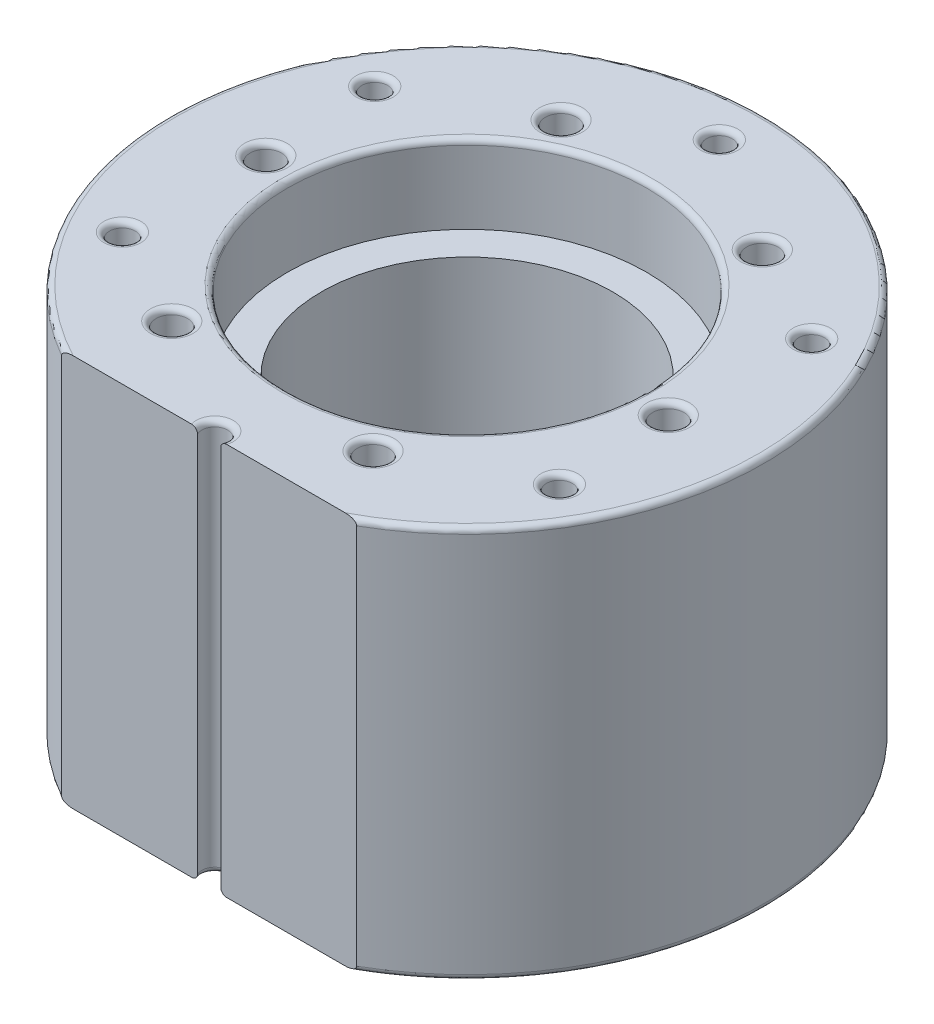
from build123d import *

# Parameters (mm, degrees)
SKETCH2_R          = 1.4
CUT_EXTRUDE1_DEPTH = 20
SKETCH4_R          = 1.15
CUT_EXTRUDE2_DEPTH = 52.278650528
FILLET1_R          = 0.5
SKETCH6_W          = 121.102594462
SKETCH6_H          = 9.633160923
CUT_EXTRUDE3_DEPTH = 52.278650528


with BuildPart() as part:
    # Sketch1 → Revolve1 (revolve)
    with BuildSketch(Plane.XY):
        Polygon((16.025, 35), (26.5, 35), (26.5, 0), (13, 0), (13, 28), (16.025, 28), align=None)
    revolve(axis=Axis((0, 0, 0), (0, 1, 0)))

    # Sketch2 → Cut-Extrude1 (cut)
    with BuildSketch(Plane(origin=(0, 35, 0), x_dir=(1, 0, 0), z_dir=(0, 1, 0))):
        with Locations((-8.590503645, 16.975095644)):
            Circle(SKETCH2_R)
        with Locations((10.405612237, 15.92714221)):
            Circle(SKETCH2_R)
        with Locations((18.996115882, -1.047953434)):
            Circle(SKETCH2_R)
        with Locations((8.590503645, -16.975095644)):
            Circle(SKETCH2_R)
        with Locations((-10.405612237, -15.92714221)):
            Circle(SKETCH2_R)
        with Locations((-18.996115882, 1.047953434)):
            Circle(SKETCH2_R)
    extrude(amount=-CUT_EXTRUDE1_DEPTH, mode=Mode.SUBTRACT)

    # Sketch4 → Cut-Extrude2 (cut, through all)
    with BuildSketch(Plane.XZ):
        with Locations((0, 22.5)):
            Circle(SKETCH4_R)
        with Locations((19.485571585, 11.25)):
            Circle(SKETCH4_R)
        with Locations((19.485571585, -11.25)):
            Circle(SKETCH4_R)
        with Locations((0, -22.5)):
            Circle(SKETCH4_R)
        with Locations((-19.485571585, -11.25)):
            Circle(SKETCH4_R)
        with Locations((-19.485571585, 11.25)):
            Circle(SKETCH4_R)
    extrude(amount=-CUT_EXTRUDE2_DEPTH, mode=Mode.SUBTRACT)

    # Fillet1
    fillet1_edges = [part.edges().sort_by_distance(p)[0] for p in [
        (-13, 0, 0),
        (-26.5, 0, 0),
        (18.335571585, 0, 11.25),
        (18.335571585, 0, -11.25),
        (-1.15, 0, -22.5),
        (-20.635571585, 0, -11.25),
        (-20.635571585, 0, 11.25),
        (-1.15, 0, 22.5),
        (-26.5, 35, 0),
        (-16.025, 35, 0),
        (-9.990503645, 35, -16.975095644),
        (9.005612237, 35, -15.92714221),
        (17.596115882, 35, 1.047953434),
        (7.190503645, 35, 16.975095644),
        (-11.805612237, 35, 15.92714221),
        (-20.396115882, 35, -1.047953434),
        (18.335571585, 35, 11.25),
        (18.335571585, 35, -11.25),
        (-1.15, 35, -22.5),
        (-20.635571585, 35, -11.25),
        (-20.635571585, 35, 11.25),
        (-1.15, 35, 22.5),
    ]]
    fillet(fillet1_edges, radius=FILLET1_R)

    # Sketch6 → Cut-Extrude3 (cut, through all)
    with BuildSketch(Plane(origin=(0, 35, 0), x_dir=(1, 0, 0), z_dir=(0, 1, 0))):
        with Locations((0.779827313, -27.816580462)):
            Rectangle(SKETCH6_W, SKETCH6_H)
    extrude(amount=-CUT_EXTRUDE3_DEPTH, mode=Mode.SUBTRACT)


solid = part.part
